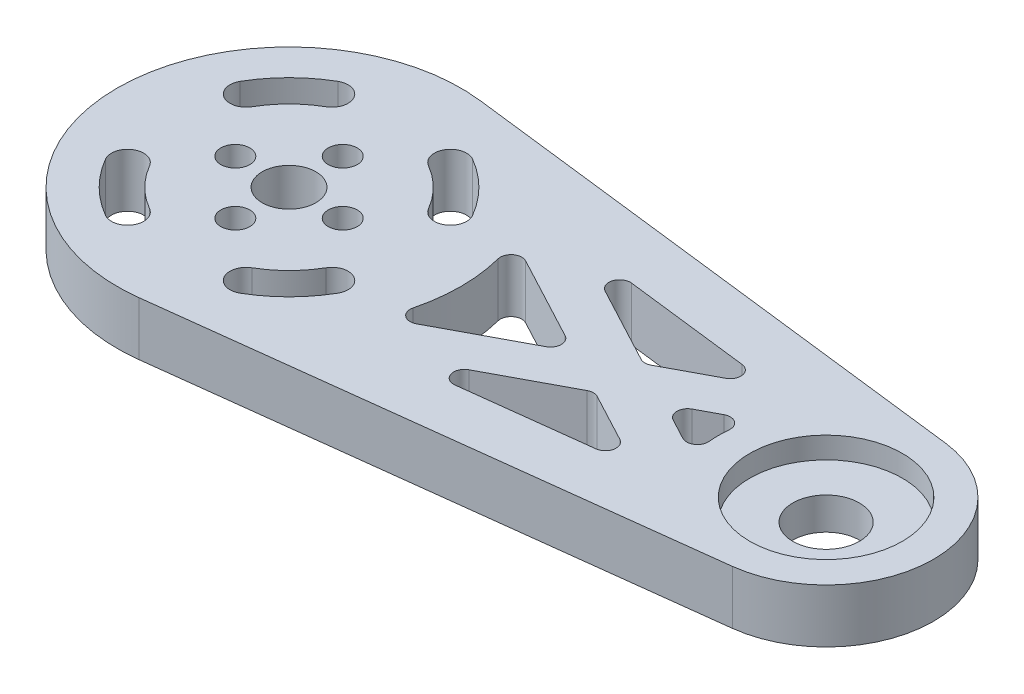
from build123d import *

# Parameters (mm, degrees)
SKETCH_1_R      = 1.35
SKETCH_1_R_2    = 2.5
SKETCH_1_R_3    = 7.1
EXTRUDE_1_DEPTH = 5
SKETCH_1_3_R    = 7.1
SKETCH_1_3_R_2  = 3.1
EXTRUDE_2_DEPTH = 3
FILLET_1_R      = 1
FILLET_2_R      = 1
FILLET_3_R      = 1
FILLET_4_R      = 1


with BuildPart() as part:
    # 草图1 → 凸台-拉伸1 (new body)
    with BuildSketch(Plane(origin=(0, 0, 0), x_dir=(1, 0, 0), z_dir=(0, 1, 0))):
        with BuildLine():
            ThreePointArc((1.92, 15.884382267), (-16, 0), (1.92, -15.884382267))
            Line((1.92, -15.884382267), (51.2, -9.927738917))
            ThreePointArc((51.2, -9.927738917), (60, 0), (51.2, 9.927738917))
            Line((51.2, 9.927738917), (1.92, 15.884382267))
        make_face()
        with BuildLine():
            ThreePointArc((-6.268918397, -10.814372942), (-8.838834765, -8.838834765), (-10.814372942, -6.268918397))
            ThreePointArc((-10.814372942, -6.268918397), (-10.268918397, -4.218923436), (-8.218923436, -4.764377982))
            ThreePointArc((-8.218923436, -4.764377982), (-6.717514421, -6.717514421), (-4.764377982, -8.218923436))
            ThreePointArc((-4.764377982, -8.218923436), (-4.218923436, -10.268918397), (-6.268918397, -10.814372942))
        make_face(mode=Mode.SUBTRACT)
        with Locations((0, -5)):
            Circle(SKETCH_1_R, mode=Mode.SUBTRACT)
        with Locations((-5, 0)):
            Circle(SKETCH_1_R, mode=Mode.SUBTRACT)
        Circle(SKETCH_1_R_2, mode=Mode.SUBTRACT)
        with BuildLine():
            ThreePointArc((10.814372942, -6.268918397), (8.838834765, -8.838834765), (6.268918397, -10.814372942))
            ThreePointArc((6.268918397, -10.814372942), (4.218923436, -10.268918397), (4.764377982, -8.218923436))
            ThreePointArc((4.764377982, -8.218923436), (6.717514421, -6.717514421), (8.218923436, -4.764377982))
            ThreePointArc((8.218923436, -4.764377982), (10.268918397, -4.218923436), (10.814372942, -6.268918397))
        make_face(mode=Mode.SUBTRACT)
        with Locations((5, 0)):
            Circle(SKETCH_1_R, mode=Mode.SUBTRACT)
        Polygon((38.535462938, -6.422151611), (18.356508588, -8.861251331), (30.734984007, -2.266153232), align=None, mode=Mode.SUBTRACT)
        with BuildLine():
            Line((40.429404433, -2.898913674), (34.988373668, 0))
            Line((34.988373668, 0), (40.429404433, 2.898913674))
            ThreePointArc((40.429404433, 2.898913674), (40, 0), (40.429404433, -2.898913674))
        make_face(mode=Mode.SUBTRACT)
        with Locations((50, 0)):
            Circle(SKETCH_1_R_3, mode=Mode.SUBTRACT)
        with BuildLine():
            ThreePointArc((-10.814372942, 6.268918397), (-8.838834765, 8.838834765), (-6.268918397, 10.814372942))
            ThreePointArc((-6.268918397, 10.814372942), (-4.218923436, 10.268918397), (-4.764377982, 8.218923436))
            ThreePointArc((-4.764377982, 8.218923436), (-6.717514421, 6.717514421), (-8.218923436, 4.764377982))
            ThreePointArc((-8.218923436, 4.764377982), (-10.268918397, 4.218923436), (-10.814372942, 6.268918397))
        make_face(mode=Mode.SUBTRACT)
        with Locations((0, 5)):
            Circle(SKETCH_1_R, mode=Mode.SUBTRACT)
        with BuildLine():
            ThreePointArc((14.72234722, -6.265180949), (16, 0), (14.72234722, 6.265180949))
            Line((14.72234722, 6.265180949), (26.481594346, 0))
            Line((26.481594346, 0), (14.72234722, -6.265180949))
        make_face(mode=Mode.SUBTRACT)
        with BuildLine():
            ThreePointArc((6.268918397, 10.814372942), (8.838834765, 8.838834765), (10.814372942, 6.268918397))
            ThreePointArc((10.814372942, 6.268918397), (10.268918397, 4.218923436), (8.218923436, 4.764377982))
            ThreePointArc((8.218923436, 4.764377982), (6.717514421, 6.717514421), (4.764377982, 8.218923436))
            ThreePointArc((4.764377982, 8.218923436), (4.218923436, 10.268918397), (6.268918397, 10.814372942))
        make_face(mode=Mode.SUBTRACT)
        Polygon((30.734984007, 2.266153232), (18.356508588, 8.861251331), (38.535462938, 6.422151611), align=None, mode=Mode.SUBTRACT)
    extrude(amount=EXTRUDE_1_DEPTH)

    # 草图1<3> → 凸台-拉伸2 (add)
    with BuildSketch(Plane(origin=(0, 0, 0), x_dir=(1, 0, 0), z_dir=(0, 1, 0))):
        with Locations((50, 0)):
            Circle(SKETCH_1_3_R)
        with Locations((50, 0)):
            Circle(SKETCH_1_3_R_2, mode=Mode.SUBTRACT)
    extrude(amount=EXTRUDE_2_DEPTH)

    # 圆角1
    fillet_1_edges = [part.edges().sort_by_distance(p)[0] for p in [
        (34.988373668, 2.5, 0),
        (40.429404433, 2.5, -2.898913674),
        (40.429404433, 2.5, 2.898913674),
    ]]
    fillet(fillet_1_edges, radius=FILLET_1_R)

    # 圆角2
    fillet_2_edges = [part.edges().sort_by_distance(p)[0] for p in [
        (30.734984007, 2.5, 2.266153232),
        (18.356508588, 2.5, 8.861251331),
        (38.535462938, 2.5, 6.422151611),
    ]]
    fillet(fillet_2_edges, radius=FILLET_2_R)

    # 圆角3
    fillet_3_edges = [part.edges().sort_by_distance(p)[0] for p in [
        (18.356508588, 2.5, -8.861251331),
        (30.734984007, 2.5, -2.266153232),
        (38.535462938, 2.5, -6.422151611),
    ]]
    fillet(fillet_3_edges, radius=FILLET_3_R)

    # 圆角4
    fillet_4_edges = [part.edges().sort_by_distance(p)[0] for p in [
        (14.72234722, 2.5, -6.265180949),
        (26.481594346, 2.5, 0),
        (14.72234722, 2.5, 6.265180949),
    ]]
    fillet(fillet_4_edges, radius=FILLET_4_R)


solid = part.part
